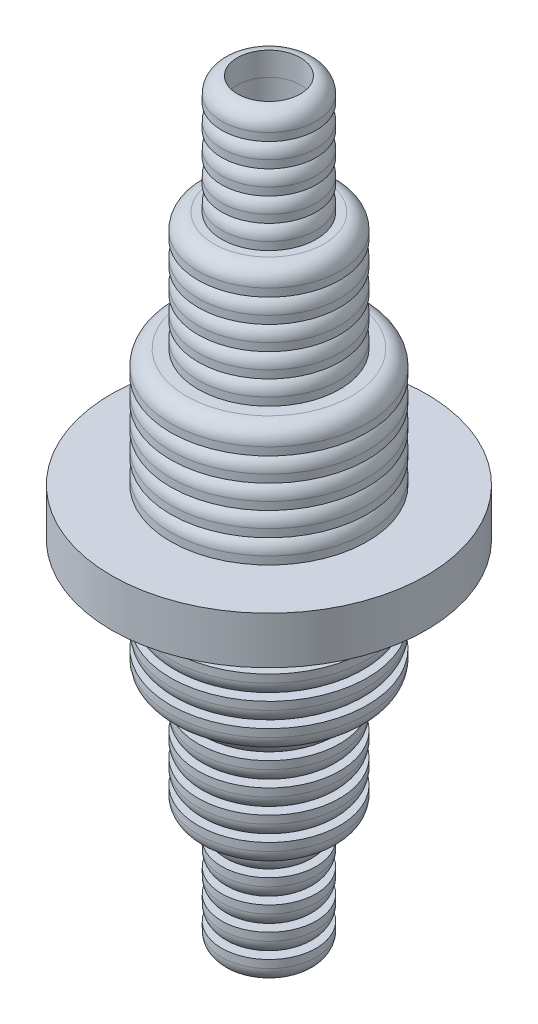
from build123d import *
from build123d.topology import SkipClean

# Parameters (mm, degrees)
SKETCH1_R            = 20
BOSS_EXTRUDE1_DEPTH  = 3
SKETCH2_R            = 12.5
BOSS_EXTRUDE2_DEPTH  = 3
FILLET1_R            = 2
SKETCH3_R            = 12.5
BOSS_EXTRUDE3_DEPTH  = 3
FILLET2_R            = 2
SKETCH4_R            = 12.5
BOSS_EXTRUDE4_DEPTH  = 3
FILLET3_R            = 2
SKETCH5_R            = 12.5
BOSS_EXTRUDE5_DEPTH  = 3
FILLET4_R            = 2
SKETCH6_R            = 12.5
BOSS_EXTRUDE6_DEPTH  = 3
FILLET5_R            = 2
SKETCH7_R            = 9
BOSS_EXTRUDE7_DEPTH  = 3
FILLET6_R            = 2
SKETCH8_R            = 9
BOSS_EXTRUDE8_DEPTH  = 3
FILLET7_R            = 2
SKETCH9_R            = 9
BOSS_EXTRUDE9_DEPTH  = 3
FILLET8_R            = 2
SKETCH10_R           = 9
BOSS_EXTRUDE10_DEPTH = 3
FILLET9_R            = 2
SKETCH11_R           = 9
BOSS_EXTRUDE11_DEPTH = 3
FILLET10_R           = 2
SKETCH12_R           = 6
BOSS_EXTRUDE12_DEPTH = 3
FILLET11_R           = 2
SKETCH13_R           = 6
BOSS_EXTRUDE13_DEPTH = 3
FILLET12_R           = 2
SKETCH14_R           = 6
BOSS_EXTRUDE14_DEPTH = 3
FILLET13_R           = 2
SKETCH15_R           = 6
BOSS_EXTRUDE15_DEPTH = 3
FILLET14_R           = 2
SKETCH16_R           = 6
BOSS_EXTRUDE16_DEPTH = 3
FILLET15_R           = 2
SKETCH17_R           = 4
CUT_EXTRUDE1_DEPTH   = 101.079968121


# Read off the part's stored shape, not the designer's step: Mirror1
with BuildPart() as part:
    # Sketch1 → Boss-Extrude1 (new body)
    with BuildSketch(Plane(origin=(0, 0, 0), x_dir=(1, 0, 0), z_dir=(0, 1, 0))):
        with Locations(Location((0, 0, 0), (0, 0, 270))):
            Circle(SKETCH1_R)
    extrude(amount=BOSS_EXTRUDE1_DEPTH)

    # Sketch2 → Boss-Extrude2 (add)
    with BuildSketch(Plane(origin=(0, 3, 0), x_dir=(1, 0, 0), z_dir=(0, 1, 0))):
        with Locations(Location((0, 0, 0), (0, 0, 270))):
            Circle(SKETCH2_R)
    extrude(amount=BOSS_EXTRUDE2_DEPTH)

    # Fillet1
    fillet1_edges = [part.edges().sort_by_distance(p)[0] for p in [
        (0, 6, -12.5),
    ]]
    fillet(fillet1_edges, radius=FILLET1_R)

    # Sketch3 → Boss-Extrude3 (add)
    with BuildSketch(Plane(origin=(0, 6, 0), x_dir=(1, 0, 0), z_dir=(0, 1, 0))):
        with Locations(Location((0, 0, 0), (0, 0, 270))):
            Circle(SKETCH3_R)
    extrude(amount=BOSS_EXTRUDE3_DEPTH)

    # Fillet2
    fillet2_edges = [part.edges().sort_by_distance(p)[0] for p in [
        (0, 9, -12.5),
    ]]
    fillet(fillet2_edges, radius=FILLET2_R)

    # Sketch4 → Boss-Extrude4 (add)
    with BuildSketch(Plane(origin=(0, 9, 0), x_dir=(1, 0, 0), z_dir=(0, 1, 0))):
        with Locations(Location((0, 0, 0), (0, 0, 270))):
            Circle(SKETCH4_R)
    extrude(amount=BOSS_EXTRUDE4_DEPTH)

    # Fillet3
    fillet3_edges = [part.edges().sort_by_distance(p)[0] for p in [
        (0, 12, -12.5),
    ]]
    fillet(fillet3_edges, radius=FILLET3_R)

    # Sketch5 → Boss-Extrude5 (add)
    with BuildSketch(Plane(origin=(0, 12, 0), x_dir=(1, 0, 0), z_dir=(0, 1, 0))):
        with Locations(Location((0, 0, 0), (0, 0, 270))):
            Circle(SKETCH5_R)
    extrude(amount=BOSS_EXTRUDE5_DEPTH)

    # Fillet4
    fillet4_edges = [part.edges().sort_by_distance(p)[0] for p in [
        (0, 15, -12.5),
    ]]
    fillet(fillet4_edges, radius=FILLET4_R)

    # Sketch6 → Boss-Extrude6 (add)
    with BuildSketch(Plane(origin=(0, 15, 0), x_dir=(1, 0, 0), z_dir=(0, 1, 0))):
        with Locations(Location((0, 0, 0), (0, 0, 270))):
            Circle(SKETCH6_R)
    extrude(amount=BOSS_EXTRUDE6_DEPTH)

    # Fillet5
    fillet5_edges = [part.edges().sort_by_distance(p)[0] for p in [
        (0, 18, -12.5),
    ]]
    fillet(fillet5_edges, radius=FILLET5_R)

    # Sketch7 → Boss-Extrude7 (add)
    with BuildSketch(Plane(origin=(0, 18, 0), x_dir=(1, 0, 0), z_dir=(0, 1, 0))):
        with Locations(Location((0, 0, 0), (0, 0, 270))):
            Circle(SKETCH7_R)
    extrude(amount=BOSS_EXTRUDE7_DEPTH)

    # Fillet6
    fillet6_edges = [part.edges().sort_by_distance(p)[0] for p in [
        (0, 21, -9),
    ]]
    fillet(fillet6_edges, radius=FILLET6_R)

    # Sketch8 → Boss-Extrude8 (add)
    with BuildSketch(Plane(origin=(0, 21, 0), x_dir=(1, 0, 0), z_dir=(0, 1, 0))):
        with Locations(Location((0, 0, 0), (0, 0, 270))):
            Circle(SKETCH8_R)
    extrude(amount=BOSS_EXTRUDE8_DEPTH)

    # Fillet7
    fillet7_edges = [part.edges().sort_by_distance(p)[0] for p in [
        (0, 24, -9),
    ]]
    fillet(fillet7_edges, radius=FILLET7_R)

    # Sketch9 → Boss-Extrude9 (add)
    with BuildSketch(Plane(origin=(0, 24, 0), x_dir=(1, 0, 0), z_dir=(0, 1, 0))):
        with Locations(Location((0, 0, 0), (0, 0, 270))):
            Circle(SKETCH9_R)
    extrude(amount=BOSS_EXTRUDE9_DEPTH)

    # Fillet8
    fillet8_edges = [part.edges().sort_by_distance(p)[0] for p in [
        (0, 27, -9),
    ]]
    fillet(fillet8_edges, radius=FILLET8_R)

    # Sketch10 → Boss-Extrude10 (add)
    with BuildSketch(Plane(origin=(0, 27, 0), x_dir=(1, 0, 0), z_dir=(0, 1, 0))):
        with Locations(Location((0, 0, 0), (0, 0, 270))):
            Circle(SKETCH10_R)
    extrude(amount=BOSS_EXTRUDE10_DEPTH)

    # Fillet9
    fillet9_edges = [part.edges().sort_by_distance(p)[0] for p in [
        (0, 30, -9),
    ]]
    fillet(fillet9_edges, radius=FILLET9_R)

    # Sketch11 → Boss-Extrude11 (add)
    with BuildSketch(Plane(origin=(0, 30, 0), x_dir=(1, 0, 0), z_dir=(0, 1, 0))):
        with Locations(Location((0, 0, 0), (0, 0, 270))):
            Circle(SKETCH11_R)
    extrude(amount=BOSS_EXTRUDE11_DEPTH)

    # Fillet10
    fillet10_edges = [part.edges().sort_by_distance(p)[0] for p in [
        (0, 33, -9),
    ]]
    fillet(fillet10_edges, radius=FILLET10_R)

    # Sketch12 → Boss-Extrude12 (add)
    with BuildSketch(Plane(origin=(0, 33, 0), x_dir=(1, 0, 0), z_dir=(0, 1, 0))):
        with Locations(Location((0, 0, 0), (0, 0, 270))):
            Circle(SKETCH12_R)
    extrude(amount=BOSS_EXTRUDE12_DEPTH)

    # Fillet11
    fillet11_edges = [part.edges().sort_by_distance(p)[0] for p in [
        (0, 36, -6),
    ]]
    fillet(fillet11_edges, radius=FILLET11_R)

    # Sketch13 → Boss-Extrude13 (add)
    with BuildSketch(Plane(origin=(0, 36, 0), x_dir=(1, 0, 0), z_dir=(0, 1, 0))):
        with Locations(Location((0, 0, 0), (0, 0, 270))):
            Circle(SKETCH13_R)
    extrude(amount=BOSS_EXTRUDE13_DEPTH)

    # Fillet12
    fillet12_edges = [part.edges().sort_by_distance(p)[0] for p in [
        (0, 39, -6),
    ]]
    fillet(fillet12_edges, radius=FILLET12_R)

    # Sketch14 → Boss-Extrude14 (add)
    with BuildSketch(Plane(origin=(0, 39, 0), x_dir=(1, 0, 0), z_dir=(0, 1, 0))):
        with Locations(Location((0, 0, 0), (0, 0, 270))):
            Circle(SKETCH14_R)
    extrude(amount=BOSS_EXTRUDE14_DEPTH)

    # Fillet13
    fillet13_edges = [part.edges().sort_by_distance(p)[0] for p in [
        (0, 42, -6),
    ]]
    fillet(fillet13_edges, radius=FILLET13_R)

    # Sketch15 → Boss-Extrude15 (add)
    with BuildSketch(Plane(origin=(0, 42, 0), x_dir=(1, 0, 0), z_dir=(0, 1, 0))):
        with Locations(Location((0, 0, 0), (0, 0, 270))):
            Circle(SKETCH15_R)
    extrude(amount=BOSS_EXTRUDE15_DEPTH)

    # Fillet14
    fillet14_edges = [part.edges().sort_by_distance(p)[0] for p in [
        (0, 45, -6),
    ]]
    fillet(fillet14_edges, radius=FILLET14_R)

    # Sketch16 → Boss-Extrude16 (add)
    with BuildSketch(Plane(origin=(0, 45, 0), x_dir=(1, 0, 0), z_dir=(0, 1, 0))):
        with Locations(Location((0, 0, 0), (0, 0, 270))):
            Circle(SKETCH16_R)
    extrude(amount=BOSS_EXTRUDE16_DEPTH)

    # Fillet15
    fillet15_edges = [part.edges().sort_by_distance(p)[0] for p in [
        (0, 48, -6),
    ]]
    fillet(fillet15_edges, radius=FILLET15_R)

    # Mirror1 outline → Mirror1 (revolve)
    with SkipClean():  # the faces are left unmerged after this step: merging them gives an invalid solid
        with BuildSketch(Plane.XY):
            with BuildLine():
                Line((20, -3), (20, 0))
                Line((20, 0), (0, 0))
                Line((0, 0), (0, -48))
                Line((0, -48), (4, -48))
                ThreePointArc((4, -48), (5.414213562, -47.414213562), (6, -46))
                Line((6, -46), (6, -45))
                Line((6, -45), (4, -45))
                ThreePointArc((4, -45), (5.414213562, -44.414213562), (6, -43))
                Line((6, -43), (6, -42))
                Line((6, -42), (4, -42))
                ThreePointArc((4, -42), (5.414213562, -41.414213562), (6, -40))
                Line((6, -40), (6, -39))
                Line((6, -39), (4, -39))
                ThreePointArc((4, -39), (5.414213562, -38.414213562), (6, -37))
                Line((6, -37), (6, -36))
                Line((6, -36), (4, -36))
                ThreePointArc((4, -36), (5.414213562, -35.414213562), (6, -34))
                Line((6, -34), (6, -33))
                Line((6, -33), (7, -33))
                ThreePointArc((7, -33), (8.414213562, -32.414213562), (9, -31))
                Line((9, -31), (9, -30))
                Line((9, -30), (7, -30))
                ThreePointArc((7, -30), (8.414213562, -29.414213562), (9, -28))
                Line((9, -28), (9, -27))
                Line((9, -27), (7, -27))
                ThreePointArc((7, -27), (8.414213562, -26.414213562), (9, -25))
                Line((9, -25), (9, -24))
                Line((9, -24), (7, -24))
                ThreePointArc((7, -24), (8.414213562, -23.414213562), (9, -22))
                Line((9, -22), (9, -21))
                Line((9, -21), (7, -21))
                ThreePointArc((7, -21), (8.414213562, -20.414213562), (9, -19))
                Line((9, -19), (9, -18))
                Line((9, -18), (10.5, -18))
                ThreePointArc((10.5, -18), (11.914213562, -17.414213562), (12.5, -16))
                Line((12.5, -16), (12.5, -15))
                Line((12.5, -15), (10.5, -15))
                ThreePointArc((10.5, -15), (11.914213562, -14.414213562), (12.5, -13))
                Line((12.5, -13), (12.5, -12))
                Line((12.5, -12), (10.5, -12))
                ThreePointArc((10.5, -12), (11.914213562, -11.414213562), (12.5, -10))
                Line((12.5, -10), (12.5, -9))
                Line((12.5, -9), (10.5, -9))
                ThreePointArc((10.5, -9), (11.914213562, -8.414213562), (12.5, -7))
                Line((12.5, -7), (12.5, -6))
                Line((12.5, -6), (10.5, -6))
                ThreePointArc((10.5, -6), (11.914213562, -5.414213562), (12.5, -4))
                Line((12.5, -4), (12.5, -3))
                Line((12.5, -3), (20, -3))
            make_face()
        revolve(axis=Axis((0, 0, 0), (0, 1, 0)))
    add(part.part.scale(1), mode=Mode.REPLACE)  # the faces are merged on a copy

    # Sketch17 → Cut-Extrude1 (cut, through all)
    with BuildSketch(Plane(origin=(0, 48, 0), x_dir=(1, 0, 0), z_dir=(0, 1, 0))):
        with Locations(Location((0, 0, 0), (0, 0, 270))):
            Circle(SKETCH17_R)
    extrude(amount=-CUT_EXTRUDE1_DEPTH, mode=Mode.SUBTRACT)


with BuildPart() as cut_extrude1_piece_1:
    # of the separate pieces the step leaves, piece 1, a body of its own (cut_extrude1_pieces)
    add(part.part.solids().sort_by_distance((0, 34, 6))[0])


with BuildPart() as cut_extrude1_piece_2:
    # of the separate pieces the step leaves, piece 2, a body of its own (cut_extrude1_pieces)
    add(part.part.solids().sort_by_distance((0, 43, 6))[0])


with BuildPart() as cut_extrude1_piece_3:
    # of the separate pieces the step leaves, piece 3, a body of its own (cut_extrude1_pieces)
    add(part.part.solids().sort_by_distance((0, 40, 6))[0])


with BuildPart() as cut_extrude1_piece_4:
    # of the separate pieces the step leaves, piece 4, a body of its own (cut_extrude1_pieces)
    add(part.part.solids().sort_by_distance((0, 37, 6))[0])


with BuildPart() as cut_extrude1_piece_5:
    # of the separate pieces the step leaves, piece 5, a body of its own (cut_extrude1_pieces)
    add(part.part.solids().sort_by_distance((0, 46, 6))[0])


with BuildPart() as cut_extrude1_piece_6:
    # of the separate pieces the step leaves, piece 6, a body of its own (cut_extrude1_pieces)
    add(part.part.solids().sort_by_distance((6, -36, 0))[0])


with BuildPart() as cut_extrude1_piece_7:
    # of the separate pieces the step leaves, piece 7, a body of its own (cut_extrude1_pieces)
    add(part.part.solids().sort_by_distance((6, -39, 0))[0])


with BuildPart() as cut_extrude1_piece_8:
    # of the separate pieces the step leaves, piece 8, a body of its own (cut_extrude1_pieces)
    add(part.part.solids().sort_by_distance((6, -42, 0))[0])


with BuildPart() as cut_extrude1_piece_9:
    # of the separate pieces the step leaves, piece 9, a body of its own (cut_extrude1_pieces)
    add(part.part.solids().sort_by_distance((6, -45, 0))[0])


solid = Compound([cut_extrude1_piece_1.part, cut_extrude1_piece_2.part, cut_extrude1_piece_3.part, cut_extrude1_piece_4.part, cut_extrude1_piece_5.part, cut_extrude1_piece_6.part, cut_extrude1_piece_7.part, cut_extrude1_piece_8.part, cut_extrude1_piece_9.part])
